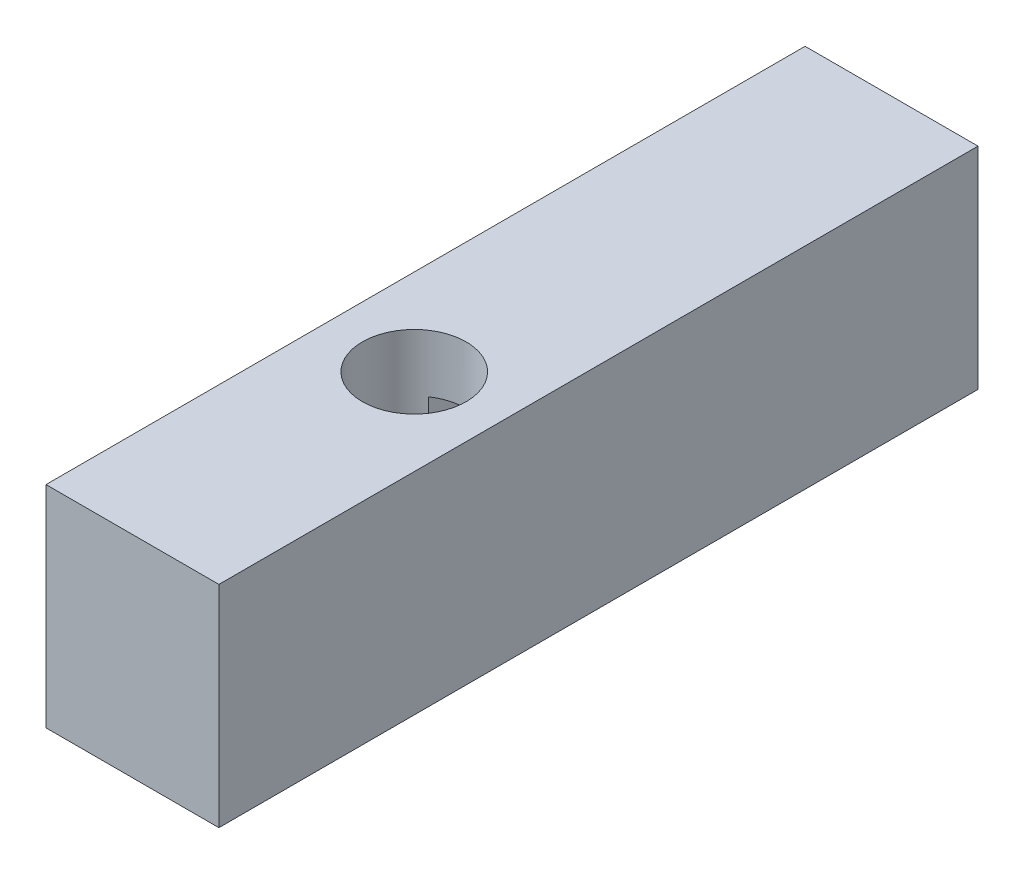
from build123d import *

# Parameters (mm, degrees)
SKETCH1_W           = 131.70814305
SKETCH1_H           = 36.561123322
BOSS_EXTRUDE1_DEPTH = 30
SHELL1_T            = 10
SKETCH2_R           = 9
CUT_EXTRUDE1_DEPTH  = 96.366309678


with BuildPart() as part:
    # Sketch1 → Boss-Extrude1 (new body)
    with BuildSketch(Plane(origin=(0, 0, 0), x_dir=(0, 0, -1), z_dir=(1, 0, 0))):
        with Locations((16.959075276, 7.158051253)):
            Rectangle(SKETCH1_W, SKETCH1_H)
    extrude(amount=BOSS_EXTRUDE1_DEPTH)

    # Shell1 (no face opened: a closed hollow body)
    add(offset(amount=-SHELL1_T, mode=Mode.PRIVATE), mode=Mode.SUBTRACT)

    # Sketch2 → Cut-Extrude1 (cut, through all)
    with BuildSketch(Plane(origin=(0, 25.438612914, 0), x_dir=(1, 0, 0), z_dir=(0, 1, 0))):
        with Locations((15, 0)):
            Circle(SKETCH2_R)
    extrude(amount=-CUT_EXTRUDE1_DEPTH, mode=Mode.SUBTRACT)


solid = part.part
